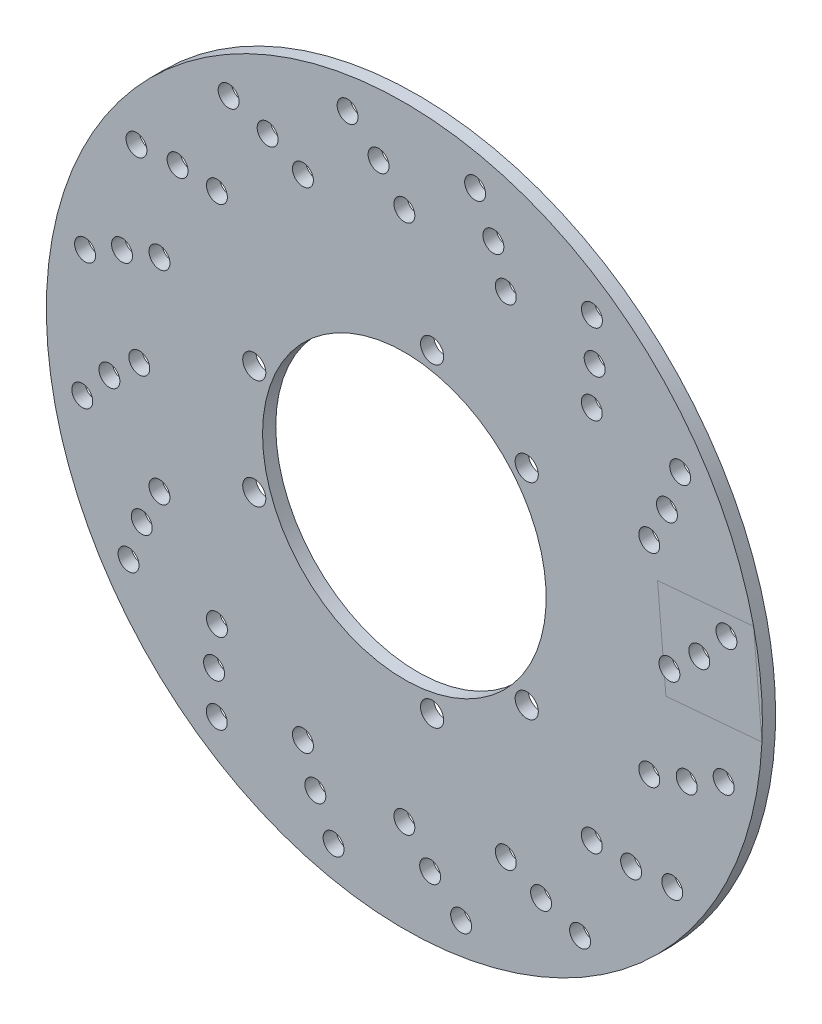
from build123d import *

# Parameters (mm, degrees)
SKETCH3_R                  = 51.5
CUT_EXTRUDE1_DEPTH         = 184.910412973
SKETCH4_R                  = 4.2
CUT_EXTRUDE2_DEPTH         = 184.910412973
F_7_6_7_6_DIAMETER_HOLE1_D = 7.6
CIRPATTERN1_COUNT          = 16


with BuildPart() as part:
    # Sketch2 → Revolve1 (revolve)
    with BuildSketch(Plane(origin=(0, 0, 0), x_dir=(1, 0, 0), z_dir=(0, 1, 0))):
        Polygon((0, 0), (0, 4.8), (-71, 4.8), (-85, 4.8), (-130, 4.8), (-130, 0), (-85.388145661, 0), (-70.464060379, 0), align=None)
    revolve(axis=Axis((0, 0, 0), (0, 0, -1)))

    # Sketch3 → Cut-Extrude1 (cut, through all)
    with BuildSketch(Plane(origin=(0, 0, -4.8), x_dir=(-1, 0, 0), z_dir=(0, 0, -1))):
        Circle(SKETCH3_R)
    extrude(amount=-CUT_EXTRUDE1_DEPTH, mode=Mode.SUBTRACT)

    # Sketch4 → Cut-Extrude2 (cut, through all)
    with BuildSketch(Plane(origin=(0, 0, -4.8), x_dir=(-1, 0, 0), z_dir=(0, 0, -1))):
        with Locations((-10.071594305, -57.118849675)):
            Circle(SKETCH4_R)
        with Locations((-44.430577701, -37.281681362)):
            Circle(SKETCH4_R)
        with Locations((54.502172006, -19.837168313)):
            Circle(SKETCH4_R)
        with Locations((54.502172006, 19.837168313)):
            Circle(SKETCH4_R)
        with Locations((-10.071594305, 57.118849675)):
            Circle(SKETCH4_R)
        with Locations((-44.430577701, 37.281681362)):
            Circle(SKETCH4_R)
    extrude(amount=-CUT_EXTRUDE2_DEPTH, mode=Mode.SUBTRACT)

    # Ø7.6 (7.6) Diameter Hole1 (through all)
    with Locations(Plane(origin=(0, 0, -4.8), x_dir=(-1, 0, 0), z_dir=(0, 0, -1))):
        with Locations((116.94592067, -20.620721098), (96.25, 0), (107.090930045, -9.369242345)):
            f_7_6_7_6_diameter_hole1 = Hole(F_7_6_7_6_DIAMETER_HOLE1_D / 2)

    # CirPattern1: Ø7.6 (7.6) Diameter Hole1 ×16 about axis
    cirpattern1_axis = Axis((0, 0, -4.8), (0, 0, -1))
    for i in range(1, CIRPATTERN1_COUNT):
        add(f_7_6_7_6_diameter_hole1.rotate(cirpattern1_axis, i * 360 / CIRPATTERN1_COUNT), mode=Mode.SUBTRACT)


solid = part.part
